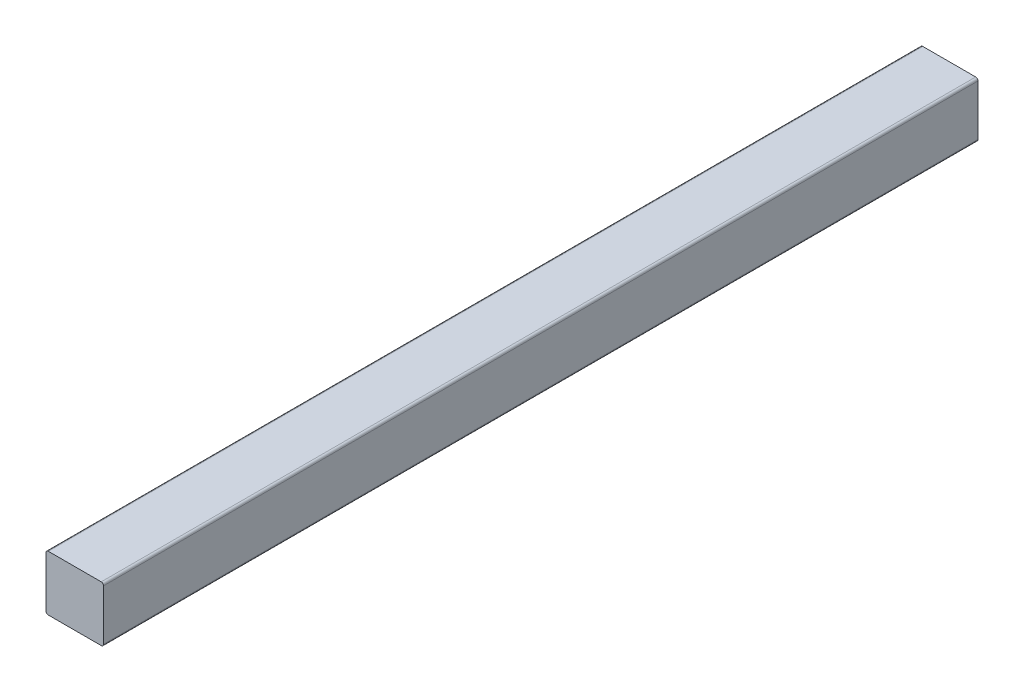
from build123d import *

# Parameters (mm, degrees)
BOSS_EXTRUDE1_DEPTH = 760


with BuildPart() as part:
    # Sketch1 → Boss-Extrude1 (new body)
    with BuildSketch(Plane.XY):
        with BuildLine():
            Line((2, 0), (48, 0))
            ThreePointArc((48, 0), (49.414213562, 0.585786438), (50, 2))
            Line((50, 2), (50, 46))
            ThreePointArc((50, 46), (49.414213562, 47.414213562), (48, 48))
            Line((48, 48), (2, 48))
            ThreePointArc((2, 48), (0.585786438, 47.414213562), (0, 46))
            Line((0, 46), (0, 2))
            ThreePointArc((0, 2), (0.585786438, 0.585786438), (2, 0))
        make_face()
    extrude(amount=BOSS_EXTRUDE1_DEPTH)


solid = part.part
